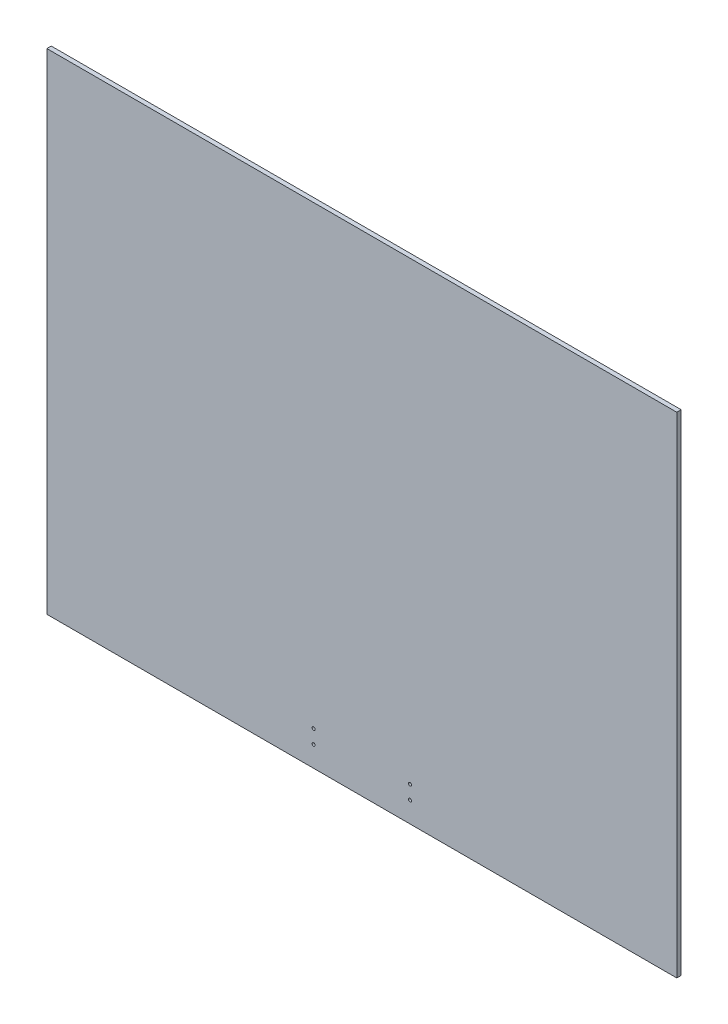
from build123d import *

# Parameters (mm, degrees)
SKETCH1_W           = 914.4
SKETCH1_H           = 711.2
BOSS_EXTRUDE1_DEPTH = 6.35
SKETCH2_R           = 2.2
CUT_EXTRUDE2_DEPTH  = 580.243923145


with BuildPart() as part:
    # Sketch1 → Boss-Extrude1 (new body)
    with BuildSketch(Plane.XY):
        Rectangle(SKETCH1_W, SKETCH1_H)
    extrude(amount=BOSS_EXTRUDE1_DEPTH)

    # Sketch2 → Cut-Extrude2 (cut, through all)
    with BuildSketch(Plane.XY.offset(6.35)):
        with Locations((70, -305.6)):
            Circle(SKETCH2_R)
        with Locations((70, -325.6)):
            Circle(SKETCH2_R)
        with Locations((-70, -325.6)):
            Circle(SKETCH2_R)
        with Locations((-70, -305.6)):
            Circle(SKETCH2_R)
    extrude(amount=-CUT_EXTRUDE2_DEPTH, mode=Mode.SUBTRACT)


solid = part.part
